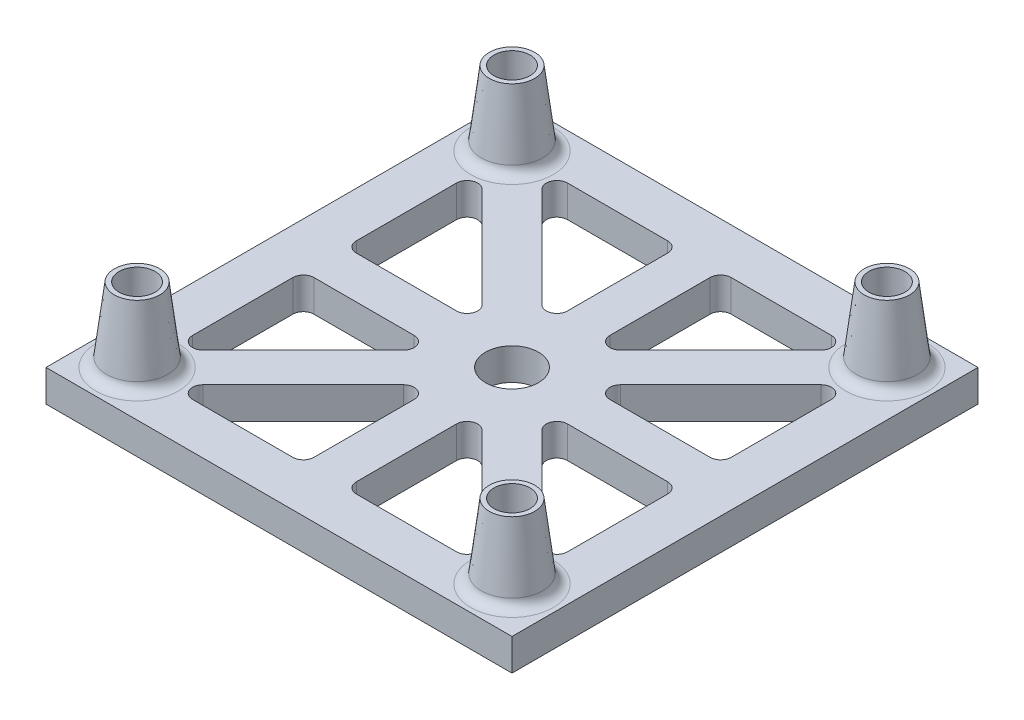
from build123d import *

# Parameters (mm, degrees)
SKETCH1_W                = 44
SKETCH1_H                = 44
BOSS_EXTRUDE1_DEPTH      = 3
SKETCH2_R                = 3
BOSS_EXTRUDE2_DEPTH      = 7
BOSS_EXTRUDE2_TAPER      = 7
SKETCH4_R                = 2.5
CUT_EXTRUDE1_DEPTH       = 32.89043746
FILLET2_R                = 1
CIRPATTERN1_COUNT        = 4
FILLET2_OF_CIRPATTERN1_R = 1
FILLET3_R                = 1


with BuildPart() as part:
    # Sketch1 → Boss-Extrude1 (new body)
    with BuildSketch(Plane(origin=(0, 0, 0), x_dir=(1, 0, 0), z_dir=(0, 1, 0))):
        Rectangle(SKETCH1_W, SKETCH1_H)
    extrude(amount=BOSS_EXTRUDE1_DEPTH)

    # Sketch2 → Boss-Extrude2 (add)
    with BuildSketch(Plane(origin=(0, 3, 0), x_dir=(1, 0, 0), z_dir=(0, 1, 0))):
        with Locations((-17.7, 17.7)):
            Circle(SKETCH2_R)
    boss_extrude2 = extrude(amount=BOSS_EXTRUDE2_DEPTH, taper=BOSS_EXTRUDE2_TAPER)

    # Sketch3 → Cut-Revolve1 (revolve, cut)
    with BuildSketch(Plane(origin=(-17.7, 0, 0), x_dir=(0, 1, 0), z_dir=(-1, 0, 0)), mode=Mode.PRIVATE) as cut_revolve1_sk:
        Polygon((0, 17.7), (0, 20.5), (1.8, 20.182611435), (3.8, 20.182611435), (3.8, 19.4), (10, 19.4), (10, 17.7), align=None)
    cut_revolve1 = revolve(cut_revolve1_sk.sketch.rotate(Axis((-17.7, 10, -17.7), (0, -1, 0)), 180), axis=Axis((-17.7, 10, -17.7), (0, -1, 0)), mode=Mode.SUBTRACT)

    # Sketch4 → Cut-Extrude1 (cut, through all)
    with BuildSketch(Plane(origin=(0, 3, 0), x_dir=(1, 0, 0), z_dir=(0, 1, 0))):
        with Locations(Location((0, 0, 0), (0, 0, 270))):
            Circle(SKETCH4_R)
        Polygon((-14.871572875, 17.7), (-2, 17.7), (-2, 4.828427125), align=None)
        Polygon((-17.7, 2), (-4.828427125, 2), (-17.7, 14.871572875), align=None)
    cut_extrude1 = extrude(amount=-CUT_EXTRUDE1_DEPTH, mode=Mode.SUBTRACT)

    # Fillet2
    # the kernel refuses this fillet: 1 mm, written as the material it adds along each edge
    with BuildSketch(Plane(origin=(-2, 3, -4.828427125), x_dir=(0, 0, -1), z_dir=(0, -1, 0)), Plane(origin=(-14.871572875, 3, -17.7), x_dir=(0.7071067811865476, 0, 0.7071067811865476), z_dir=(0, -1, 0)), Plane(origin=(-17.7, 3, -14.871572875), x_dir=(0, 0, 1), z_dir=(0, -1, 0))) as fillet2_piece_1:
        with BuildLine():
            CenterArc((FILLET2_R * 2.41421356237, -FILLET2_R), FILLET2_R, 90, 135)
            Line((FILLET2_R * 1.70710678119, -FILLET2_R * 1.70710678119), (0, 0))
            Line((0, 0), (FILLET2_R * 2.41421356237, 0))
        make_face()
    extrude(amount=3)
    with BuildSketch(Plane(origin=(-2, 3, -17.7), x_dir=(0, 0, 1), z_dir=(0, -1, 0))) as fillet2_piece_2:
        with BuildLine():
            CenterArc((FILLET2_R, FILLET2_R), FILLET2_R, 180, 90)
            Line((0, FILLET2_R), (0, 0))
            Line((0, 0), (FILLET2_R, 0))
        make_face()
    extrude(amount=3)
    with BuildSketch(Plane(origin=(-17.7, 3, -2), x_dir=(1, 0, 0), z_dir=(0, -1, 0))) as fillet2_piece_3:
        with BuildLine():
            CenterArc((FILLET2_R, -FILLET2_R), FILLET2_R, 90, 90)
            Line((0, -FILLET2_R), (0, 0))
            Line((0, 0), (FILLET2_R, 0))
        make_face()
    extrude(amount=3)
    with BuildSketch(Plane(origin=(-4.828427125, 3, -2), x_dir=(-1, 0, 0), z_dir=(0, -1, 0))) as fillet2_piece_4:
        with BuildLine():
            CenterArc((FILLET2_R * 2.41421356237, FILLET2_R), FILLET2_R, 135, 135)
            Line((FILLET2_R * 1.70710678119, FILLET2_R * 1.70710678119), (0, 0))
            Line((0, 0), (FILLET2_R * 2.41421356237, 0))
        make_face()
    extrude(amount=3)

    # CirPattern1: Boss-Extrude2, Cut-Revolve1, Cut-Extrude1 ×4 about axis
    cirpattern1_axis = Axis((0, 0, 0), (0, 1, 0))
    add([boss_extrude2.rotate(cirpattern1_axis, i * 360 / CIRPATTERN1_COUNT) for i in range(1, CIRPATTERN1_COUNT)])
    add([cut_revolve1.rotate(cirpattern1_axis, i * 360 / CIRPATTERN1_COUNT) for i in range(1, CIRPATTERN1_COUNT)], mode=Mode.SUBTRACT)
    add([cut_extrude1.rotate(cirpattern1_axis, i * 360 / CIRPATTERN1_COUNT) for i in range(1, CIRPATTERN1_COUNT)], mode=Mode.SUBTRACT)

    # Fillet2 of CirPattern1
    # the kernel refuses this fillet: 1 mm, written as the material it adds along each edge
    with BuildSketch(Plane(origin=(-4.828427125, 3, 2), x_dir=(-1, 0, 0), z_dir=(0, -1, 0)), Plane(origin=(-2, 3, 4.828427125), x_dir=(-0.7071067811865477, 0, 0.7071067811865475), z_dir=(0, -1, 0)), Plane(origin=(2, 3, 4.828427125), x_dir=(0, 0, 1), z_dir=(0, -1, 0)), Plane(origin=(4.828427125, 3, 2), x_dir=(0.7071067811865475, 0, 0.7071067811865475), z_dir=(0, -1, 0)), Plane(origin=(4.828427125, 3, -2), x_dir=(1, 0, 0), z_dir=(0, -1, 0)), Plane(origin=(2, 3, -4.828427125), x_dir=(0.7071067811865476, 0, -0.7071067811865476), z_dir=(0, -1, 0))) as fillet2_of_cirpattern1_piece_1:
        with BuildLine():
            CenterArc((FILLET2_OF_CIRPATTERN1_R * 2.41421356237, -FILLET2_OF_CIRPATTERN1_R), FILLET2_OF_CIRPATTERN1_R, 90, 135)
            Line((FILLET2_OF_CIRPATTERN1_R * 1.70710678119, -FILLET2_OF_CIRPATTERN1_R * 1.70710678119), (0, 0))
            Line((0, 0), (FILLET2_OF_CIRPATTERN1_R * 2.41421356237, 0))
        make_face()
    extrude(amount=3)
    with BuildSketch(Plane(origin=(-17.7, 3, 14.871572875), x_dir=(0, 0, -1), z_dir=(0, -1, 0)), Plane(origin=(-14.871572875, 3, 17.7), x_dir=(0.7071067811865471, 0, -0.7071067811865479), z_dir=(0, -1, 0)), Plane(origin=(14.871572875, 3, 17.7), x_dir=(-1, 0, 0), z_dir=(0, -1, 0)), Plane(origin=(17.7, 3, 14.871572875), x_dir=(-0.7071067811865469, 0, -0.7071067811865483), z_dir=(0, -1, 0)), Plane(origin=(17.7, 3, -14.871572875), x_dir=(0, 0, 1), z_dir=(0, -1, 0)), Plane(origin=(14.871572875, 3, -17.7), x_dir=(-0.7071067811865487, 0, 0.7071067811865465), z_dir=(0, -1, 0))) as fillet2_of_cirpattern1_piece_2:
        with BuildLine():
            CenterArc((FILLET2_OF_CIRPATTERN1_R * 2.41421356237, FILLET2_OF_CIRPATTERN1_R), FILLET2_OF_CIRPATTERN1_R, 135, 135)
            Line((FILLET2_OF_CIRPATTERN1_R * 1.70710678119, FILLET2_OF_CIRPATTERN1_R * 1.70710678119), (0, 0))
            Line((0, 0), (FILLET2_OF_CIRPATTERN1_R * 2.41421356237, 0))
        make_face()
    extrude(amount=3)
    with BuildSketch(Plane(origin=(-17.7, 3, 2), x_dir=(1, 0, 0), z_dir=(0, -1, 0)), Plane(origin=(-2, 3, 17.7), x_dir=(-1, 0, 0), z_dir=(0, -1, 0)), Plane(origin=(2, 3, 17.7), x_dir=(0, 0, -1), z_dir=(0, -1, 0)), Plane(origin=(17.7, 3, 2), x_dir=(0, 0, 1), z_dir=(0, -1, 0)), Plane(origin=(17.7, 3, -2), x_dir=(-1, 0, 0), z_dir=(0, -1, 0)), Plane(origin=(2, 3, -17.7), x_dir=(1, 0, 0), z_dir=(0, -1, 0))) as fillet2_of_cirpattern1_piece_3:
        with BuildLine():
            CenterArc((FILLET2_OF_CIRPATTERN1_R, FILLET2_OF_CIRPATTERN1_R), FILLET2_OF_CIRPATTERN1_R, 180, 90)
            Line((0, FILLET2_OF_CIRPATTERN1_R), (0, 0))
            Line((0, 0), (FILLET2_OF_CIRPATTERN1_R, 0))
        make_face()
    extrude(amount=3)

    # Fillet3
    fillet3_edges = [part.edges().sort_by_distance(p)[0] for p in [
        (-17.7, 3, 20.7),
        (20.7, 3, 17.7),
        (17.7, 3, -20.7),
        (-20.7, 3, -17.7),
    ]]
    fillet(fillet3_edges, radius=FILLET3_R)


solid = part.part
